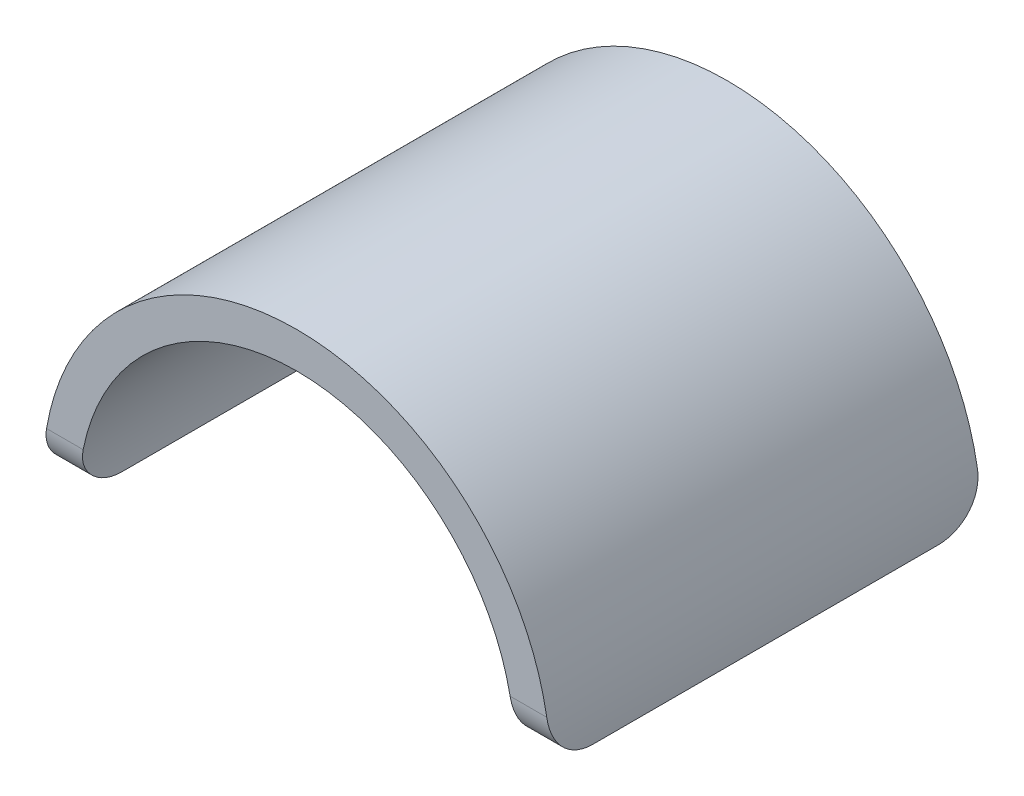
from build123d import *

# Parameters (mm, degrees)
ESTRUSIONE_ESTRUSIONE2_DEPTH = 50.29206128
RACCORDO1_R                  = 5


with BuildPart() as part:
    # Schizzo1 → Estrusione-Estrusione2 (new body)
    with BuildSketch(Plane.XY):
        with BuildLine():
            Line((-29.628026169, 0), (-25.424228997, 0))
            ThreePointArc((-25.424228997, 0), (0, 25.424228997), (25.424228997, 0))
            Line((25.424228997, 0), (29.628026169, 0))
            ThreePointArc((29.628026169, 0), (0, 29.628026169), (-29.628026169, 0))
        make_face()
    extrude(amount=ESTRUSIONE_ESTRUSIONE2_DEPTH)

    # Raccordo1
    raccordo1_edges = [part.edges().sort_by_distance(p)[0] for p in [
        (-27.526127583, 0, 50.29206128),
        (27.526127583, 0, 50.29206128),
        (-27.526127583, 0, 0),
        (27.526127583, 0, 0),
    ]]
    fillet(raccordo1_edges, radius=RACCORDO1_R)


solid = part.part
